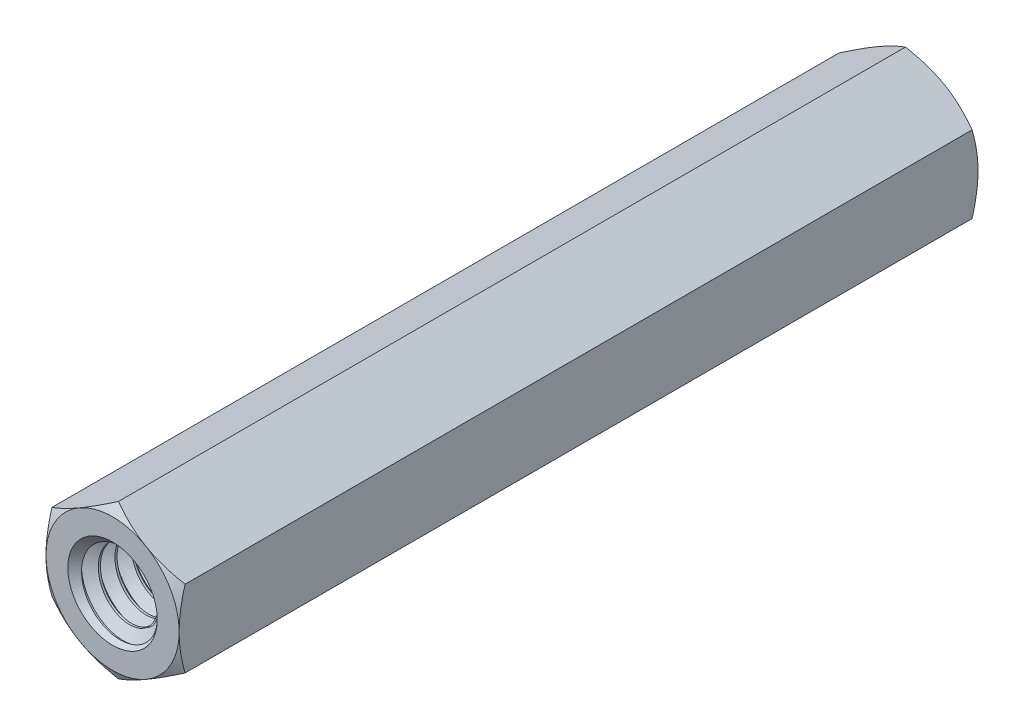
from build123d import *

# Parameters (mm, degrees)
EXTRUDE1_DEPTH          = 19.05
EXTRUDE1_DEPTH_BACK     = 19.05
SKETCH1_R               = 2.0828
SWEEP1_PITCH            = 0.79375
EXTRUDE2_DEPTH          = 40.195136557
SKETCH8_OUTSIDE_W       = 155.608
SKETCH8_OUTSIDE_H       = 156.59
SKETCH8_OUTSIDE_R       = 3.175
EXTRUDE4_DEPTH          = 40.195136557
EXTRUDE4_DRAFT          = -60
MIRROR1_COPY_1_SKETCH_W = 155.608
MIRROR1_COPY_1_SKETCH_H = 156.59
MIRROR1_COPY_1_SKETCH_R = 3.175
MIRROR1_COPY_1_DEPTH    = 40.195136557
MIRROR1_COPY_1_DRAFT    = -60
SKETCH9_W               = 19.05
SKETCH9_H               = 2.1336


with BuildPart() as part:
    # Sketch1 → Extrude1 (new, two sides: drawn at the far end of the back side and taken through both)
    with BuildSketch(Plane.XY.offset(-EXTRUDE1_DEPTH_BACK)):
        Polygon((0, 3.666174209), (-3.175, 1.833087105), (-3.175, -1.833087105), (0, -3.666174209), (3.175, -1.833087105), (3.175, 1.833087105), align=None)
        with Locations(Location((0, 0, 0), (0, 0, 180))):
            Circle(SKETCH1_R, mode=Mode.SUBTRACT)
    extrude(amount=EXTRUDE1_DEPTH + EXTRUDE1_DEPTH_BACK)

    # Sweep1: arcs per turn and ends read off the stored shape
    # Sweep1: the profile of Sketch12 profile screwed along a right-hand helix through 49 turns, 8 arcs to a turn; built about Z, then put on its axis
    sweep1_z = Axis((0, 0, 0), (0, 0, 1))
    sweep1_corners = [(2.0831, 0, -0.694704455), (2.0831, 0, 0.000173205), (1.567244252, 0, -0.29765625), (1.567244252, 0, -0.396875)]
    with BuildLine(mode=Mode.PRIVATE) as sweep1_profile:
        Line(sweep1_corners[0], sweep1_corners[1])
        Line(sweep1_corners[1], sweep1_corners[2])
        Line(sweep1_corners[2], sweep1_corners[3])
        Line(sweep1_corners[3], sweep1_corners[0])
    sweep1_cap = Face(sweep1_profile.wire())
    sweep1_turn_angles = [0, 22.5, 45, 67.5, 90, 112.5, 135, 157.5, 180, 202.5, 225, 247.5, 270, 292.5, 315, 337.5, 360]
    sweep1_turn_weights = [1, 0.9238795325112867, 1, 0.9238795325112867, 1, 0.9238795325112867, 1, 0.9238795325112867, 1, 0.9238795325112867, 1, 0.9238795325112867, 1, 0.9238795325112867, 1, 0.9238795325112867, 1]
    sweep1_turn_rails = [Edge.make_bspline([Vector(p[0], p[1], 0).rotate(sweep1_z, sweep1_turn_angles[k]) / sweep1_turn_weights[k] + Vector(0, 0, p[2] + SWEEP1_PITCH * sweep1_turn_angles[k] / 360) for k in range(17)], [0, 0, 0, 1, 1, 2, 2, 3, 3, 4, 4, 5, 5, 6, 6, 7, 7, 8, 8, 8], 2, sweep1_turn_weights) for p in sweep1_corners]
    sweep1_turn_sides = [Face.make_surface_from_curves(sweep1_turn_rails[p[0]], sweep1_turn_rails[p[1]]) for p in [(0, 1), (1, 2), (2, 3), (3, 0)]]
    sweep1 = Plane(origin=(0, 0, -19.05), x_dir=(0, 1, 0), z_dir=(0, 0, 1)) * Solid(Shell([*[p.moved(Location((0, 0, SWEEP1_PITCH * i))) for i in range(49) for p in sweep1_turn_sides], sweep1_cap, sweep1_cap.rotate(sweep1_z, 17640).moved(Location((0, 0, SWEEP1_PITCH * 17640 / 360)))]))
    add(sweep1)

    # Sketch6 → Extrude2 (cut, through all)
    with BuildSketch(Plane(origin=(0, 0, -19.05), x_dir=(-1, 0, 0), z_dir=(0, 0, -1))):
        Polygon((0, 3.666174209), (-3.175, 1.833087105), (-3.175, -1.833087105), (0, -3.666174209), (3.175, -1.833087105), (3.175, 1.833087105), align=None)
    extrude2 = extrude(amount=EXTRUDE2_DEPTH, mode=Mode.SUBTRACT)

    # Extrude3 cone 1 section (through the dimple's axis) → Extrude3 (revolve, cut)
    with BuildSketch(Plane(origin=(0, 0, -19.05), x_dir=(0, 1, 0), z_dir=(1, 0, 0))):
        Polygon((0, 0), (2.1336, 0), (0, 2.28800588), align=None)
    extrude3 = revolve(axis=Axis((0, 0, -19.05), (0, 0, 1)), mode=Mode.SUBTRACT)


with BuildPart() as extrude4_tool:
    # Sketch8 outside → Extrude4 (with draft: the straight prism first)
    with BuildSketch(Plane(origin=(0, 0, -19.05), x_dir=(-1, 0, 0), z_dir=(0, 0, -1))):
        Rectangle(SKETCH8_OUTSIDE_W, SKETCH8_OUTSIDE_H)
        Circle(SKETCH8_OUTSIDE_R, mode=Mode.SUBTRACT)
    extrude(amount=-EXTRUDE4_DEPTH)
    # Extrude4: the draft: its side faces are tilted about the plane it starts from
    extrude4_sides = [extrude4_tool.faces().sort_by_distance(p)[0] for p in [
        (0, -78.295, 1.047568279),
        (-77.804, 0, 1.047568279),
        (0, 78.295, 1.047568279),
        (77.804, 0, 1.047568279),
        (3.175, 0, 1.047568279),
    ]]
    draft(extrude4_sides, Plane(origin=(0, 0, -19.05), x_dir=(-1, 0, 0), z_dir=(0, 0, -1)), EXTRUDE4_DRAFT)


with BuildPart() as part_1:
    add(part.part)

    # Extrude4: cut by extrude4_tool
    add(extrude4_tool.part, mode=Mode.SUBTRACT)

    # Mirror1: Extrude2, Extrude3 across plane
    add(extrude2.mirror(Plane.XY), mode=Mode.SUBTRACT)
    add(extrude3.mirror(Plane.XY), mode=Mode.SUBTRACT)


with BuildPart() as mirror1_copy_1_tool:
    # Mirror1 copy 1 sketch → Mirror1 copy 1 (with draft: the straight prism first)
    with BuildSketch(Plane(origin=(0, 0, 19.05), x_dir=(-1, 0, 0), z_dir=(0, 0, 1))):
        Rectangle(MIRROR1_COPY_1_SKETCH_W, MIRROR1_COPY_1_SKETCH_H)
        Circle(MIRROR1_COPY_1_SKETCH_R, mode=Mode.SUBTRACT)
    extrude(amount=-MIRROR1_COPY_1_DEPTH)
    # Mirror1 copy 1: the draft: its side faces are tilted about the plane it starts from
    mirror1_copy_1_sides = [mirror1_copy_1_tool.faces().sort_by_distance(p)[0] for p in [
        (0, -78.295, -1.047568279),
        (-77.804, 0, -1.047568279),
        (0, 78.295, -1.047568279),
        (77.804, 0, -1.047568279),
        (3.175, 0, -1.047568279),
    ]]
    draft(mirror1_copy_1_sides, Plane(origin=(0, 0, 19.05), x_dir=(-1, 0, 0), z_dir=(0, 0, 1)), MIRROR1_COPY_1_DRAFT)


with BuildPart() as part_2:
    add(part_1.part)

    # Mirror1 copy 1: cut by mirror1_copy_1_tool
    add(mirror1_copy_1_tool.part, mode=Mode.SUBTRACT)

    # Sketch9 → Revolve 2 (revolve)
    with BuildSketch(Plane(origin=(0, 0, 0), x_dir=(0, 0, -1), z_dir=(1, 0, 0)), mode=Mode.PRIVATE) as revolve_2_sk:
        with Locations((0, 1.0668)):
            Rectangle(SKETCH9_W, SKETCH9_H)
    revolve(revolve_2_sk.sketch.rotate(Axis((0, 0, 19.05), (0, 0, -1)), 270), axis=Axis((0, 0, 19.05), (0, 0, -1)))


solid = part_2.part
